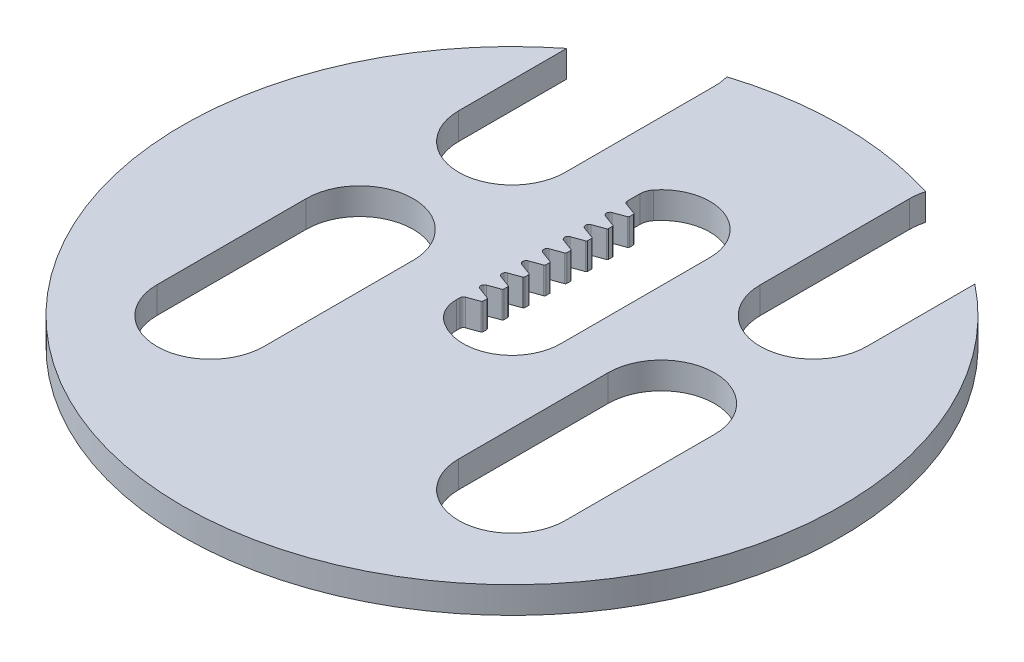
from build123d import *

# Parameters (mm, degrees)
BOSS_EXTRUDE1_DEPTH = 3.175
BOSS_EXTRUDE3_START = -3.175
BOSS_EXTRUDE3_DEPTH = 3.175


# Read off the part's stored shape, not the designer's step: Boss-Extrude3
with BuildPart() as part:
    # Sketch3 → Boss-Extrude1 (new body)
    with BuildSketch(Plane.XZ):
        with BuildLine():
            ThreePointArc((39.2557, 0), (-17.127226966, 35.322345321), (-24.310512242, -30.822215641))
            Line((-24.310512242, -30.822215641), (-24.310512242, -17.960512242))
            ThreePointArc((-24.310512242, -17.960512242), (-17.960512242, -11.610512242), (-11.610512242, -17.960512242))
            Line((-11.610512242, -17.960512242), (-11.610512242, -35.740512242))
            ThreePointArc((-11.610512242, -35.740512242), (-11.667849962, -36.591923676), (-11.838827653, -37.427959366))
            ThreePointArc((-11.838827653, -37.427959366), (0, -39.2557), (11.838827653, -37.427959366))
            ThreePointArc((11.838827653, -37.427959366), (11.667849962, -36.591923676), (11.610512242, -35.740512242))
            Line((11.610512242, -35.740512242), (11.610512242, -17.960512242))
            ThreePointArc((11.610512242, -17.960512242), (17.960512242, -11.610512242), (24.310512242, -17.960512242))
            Line((24.310512242, -17.960512242), (24.310512242, -30.822215641))
            ThreePointArc((24.310512242, -30.822215641), (35.322345321, -17.127226966), (39.2557, 0))
        make_face()
        with BuildLine():
            ThreePointArc((-5.8, 0), (0, 5.8), (5.8, 0))
            Line((5.8, 0), (5.8, -17.78))
            ThreePointArc((5.8, -17.78), (0, -23.58), (-5.8, -17.78))
            Line((-5.8, -17.78), (-5.8, 0))
        make_face(mode=Mode.SUBTRACT)
        with BuildLine():
            ThreePointArc((-11.590512242, 0.180512242), (-17.960512242, -6.189487758), (-24.330512242, 0.180512242))
            Line((-24.330512242, 0.180512242), (-24.330512242, 17.960512242))
            ThreePointArc((-24.330512242, 17.960512242), (-17.960512242, 24.330512242), (-11.590512242, 17.960512242))
            Line((-11.590512242, 17.960512242), (-11.590512242, 0.180512242))
        make_face(mode=Mode.SUBTRACT)
        with BuildLine():
            ThreePointArc((24.310512242, 0.180512242), (17.960512242, -6.169487758), (11.610512242, 0.180512242))
            Line((11.610512242, 0.180512242), (11.610512242, 17.960512242))
            ThreePointArc((11.610512242, 17.960512242), (17.960512242, 24.310512242), (24.310512242, 17.960512242))
            Line((24.310512242, 17.960512242), (24.310512242, 0.180512242))
        make_face(mode=Mode.SUBTRACT)
    extrude(amount=BOSS_EXTRUDE1_DEPTH)

    # Boss-Extrude3 outline → Boss-Extrude3 (add)
    with BuildSketch(Plane(origin=(0, 0, 0), x_dir=(1, 0, 0), z_dir=(0, 1, 0)).offset(BOSS_EXTRUDE3_START)):
        with BuildLine():
            Line((-4.952891864, -1.684975141), (-4.952891864, -1.246819584))
            ThreePointArc((-4.952891864, -1.246819584), (-4.879618202, -1.014425219), (-4.6863, -0.866086946))
            Line((-4.6863, -0.866086946), (-3.328347771, -0.371832755))
            ThreePointArc((-3.328347771, -0.371832755), (-3.253985597, -0.314772651), (-3.2258, -0.22537936))
            Line((-3.2258, -0.22537936), (-3.2258, 0.22537936))
            ThreePointArc((-3.2258, 0.22537936), (-3.253985597, 0.314772651), (-3.328347771, 0.371832755))
            Line((-3.328347771, 0.371832755), (-4.6863, 0.866086946))
            ThreePointArc((-4.6863, 0.866086946), (-4.952891864, 1.246819585), (-4.6863, 1.627552223))
            Line((-4.6863, 1.627552223), (-3.328347771, 2.121806414))
            ThreePointArc((-3.328347771, 2.121806414), (-3.253985597, 2.178866518), (-3.2258, 2.268259809))
            Line((-3.2258, 2.268259809), (-3.2258, 2.719018529))
            ThreePointArc((-3.2258, 2.719018529), (-3.253985597, 2.80841182), (-3.328347771, 2.865471924))
            Line((-3.328347771, 2.865471924), (-4.6863, 3.359726115))
            ThreePointArc((-4.6863, 3.359726115), (-4.952891864, 3.740458754), (-4.6863, 4.121191392))
            Line((-4.6863, 4.121191392), (-3.328347771, 4.615445582))
            ThreePointArc((-3.328347771, 4.615445582), (-3.253985597, 4.672505686), (-3.2258, 4.761898978))
            Line((-3.2258, 4.761898978), (-3.2258, 5.212657697))
            ThreePointArc((-3.2258, 5.212657697), (-3.253985597, 5.302050989), (-3.328347771, 5.359111093))
            Line((-3.328347771, 5.359111093), (-4.6863, 5.853365283))
            ThreePointArc((-4.6863, 5.853365283), (-4.952891864, 6.234097921), (-4.6863, 6.61483056))
            Line((-4.6863, 6.61483056), (-3.328347771, 7.109084751))
            ThreePointArc((-3.328347771, 7.109084751), (-3.253985597, 7.166144855), (-3.2258, 7.255538147))
            Line((-3.2258, 7.255538147), (-3.2258, 7.706296866))
            ThreePointArc((-3.2258, 7.706296866), (-3.253985597, 7.795690157), (-3.328347771, 7.852750261))
            Line((-3.328347771, 7.852750261), (-4.6863, 8.347004452))
            ThreePointArc((-4.6863, 8.347004452), (-4.952891864, 8.72773709), (-4.6863, 9.108469729))
            Line((-4.6863, 9.108469729), (-3.328347771, 9.60272392))
            ThreePointArc((-3.328347771, 9.60272392), (-3.253985597, 9.659784024), (-3.2258, 9.749177315))
            Line((-3.2258, 9.749177315), (-3.2258, 10.199936035))
            ThreePointArc((-3.2258, 10.199936035), (-3.253985597, 10.289329326), (-3.328347771, 10.34638943))
            Line((-3.328347771, 10.34638943), (-4.6863, 10.840643621))
            ThreePointArc((-4.6863, 10.840643621), (-4.952891864, 11.221376259), (-4.6863, 11.602108898))
            Line((-4.6863, 11.602108898), (-3.328347771, 12.096363089))
            ThreePointArc((-3.328347771, 12.096363089), (-3.253985597, 12.153423193), (-3.2258, 12.242816484))
            Line((-3.2258, 12.242816484), (-3.2258, 12.693575204))
            ThreePointArc((-3.2258, 12.693575204), (-3.253985597, 12.782968495), (-3.328347771, 12.840028599))
            Line((-3.328347771, 12.840028599), (-4.6863, 13.33428279))
            ThreePointArc((-4.6863, 13.33428279), (-4.952891864, 13.715015428), (-4.6863, 14.095748067))
            Line((-4.6863, 14.095748067), (-3.328347771, 14.590002258))
            ThreePointArc((-3.328347771, 14.590002258), (-3.253985597, 14.647062362), (-3.2258, 14.736455653))
            Line((-3.2258, 14.736455653), (-3.2258, 15.187214372))
            ThreePointArc((-3.2258, 15.187214372), (-3.253985597, 15.276607664), (-3.328347771, 15.333667768))
            Line((-3.328347771, 15.333667768), (-4.6863, 15.827921959))
            ThreePointArc((-4.6863, 15.827921959), (-4.952891864, 16.208654598), (-4.6863, 16.589387236))
            Line((-4.6863, 16.589387236), (-3.328347771, 17.083641426))
            ThreePointArc((-3.328347771, 17.083641426), (-3.253985597, 17.14070153), (-3.2258, 17.230094822))
            Line((-3.2258, 17.230094822), (-3.2258, 17.680853541))
            ThreePointArc((-3.2258, 17.680853541), (-3.253985597, 17.770246833), (-3.328347771, 17.827306937))
            Line((-3.328347771, 17.827306937), (-4.6863, 18.321561127))
            ThreePointArc((-4.6863, 18.321561127), (-4.879618202, 18.469899401), (-4.952891864, 18.702293766))
            Line((-4.952891864, 18.702293766), (-4.952891864, 20.205203806))
            ThreePointArc((-4.952891864, 20.205203806), (-4.846345509, 20.833344029), (-4.538625549, 21.391215602))
            ThreePointArc((-4.538625549, 21.391215602), (-5.475583448, 19.692586183), (-5.8, 17.78))
            Line((-5.8, 17.78), (-5.8, 0))
            ThreePointArc((-5.8, 0), (-5.240594871, -2.485189209), (-3.670287792, -4.490989593))
            Line((-3.670287792, -4.490989593), (-3.66100885, -4.494366852))
            ThreePointArc((-3.66100885, -4.494366852), (-4.614444615, -3.231070506), (-4.952891864, -1.684975141))
        make_face()
    extrude(amount=BOSS_EXTRUDE3_DEPTH)


solid = part.part
